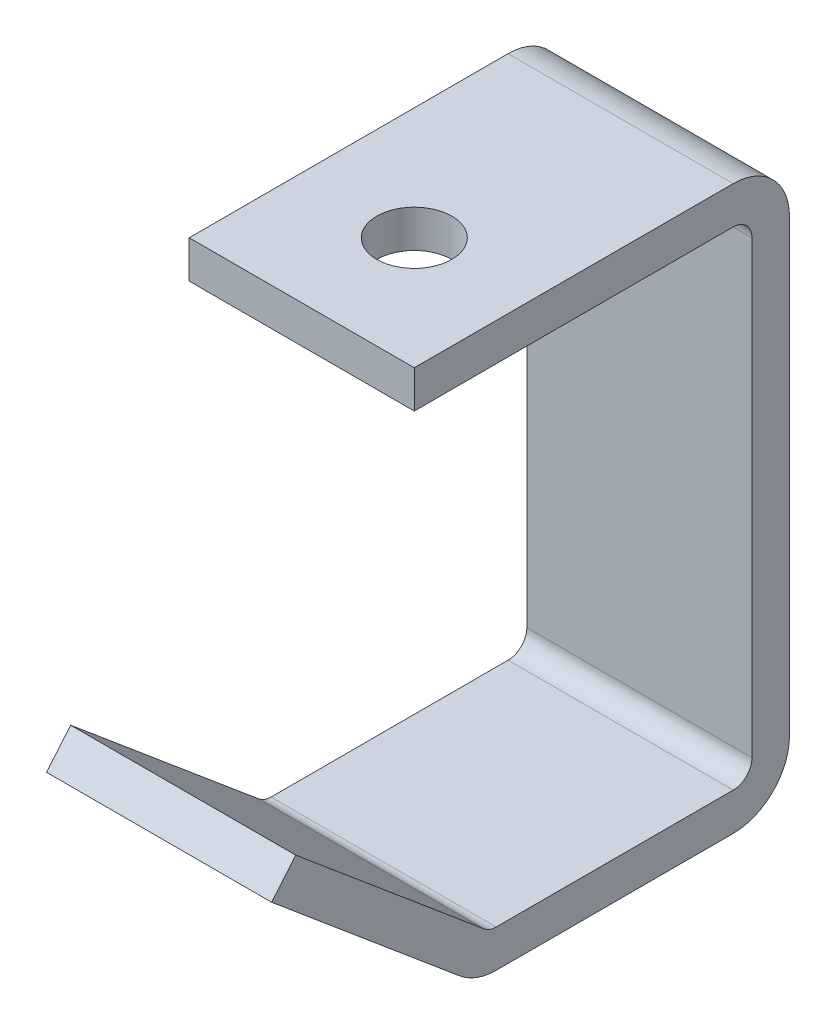
from build123d import *

# Parameters (mm, degrees)
BOSS_EXTRUDE1_DEPTH = 19.05
SHELL1_T            = 6.35
FILLET1_R           = 3.175
FILLET2_R           = 9.525
CUT_EXTRUDE1_REACH  = 128.663
SKETCH2_R           = 6.35


with BuildPart() as part:
    # Sketch1 → Boss-Extrude1 (new, symmetric)
    with BuildSketch(Plane(origin=(0, 0, 0), x_dir=(0, 0, -1), z_dir=(1, 0, 0))):
        Polygon((-57.15, 82.55), (0, 82.55), (0, 0), (-44.45, 0), (-77.208974413, 27.488043348), (-57.15, 51.393398168), align=None)
    extrude(amount=BOSS_EXTRUDE1_DEPTH, both=True)

    # Shell1
    shell1_openings = [part.faces().sort_by_distance(p)[0] for p in [
        (19.05, 40.856533518, 31.097326269),
        (0, 39.440720758, 67.179487206),
        (-19.05, 40.856533518, 31.097326269),
        (0, 66.971699084, 57.15),
    ]]
    offset(amount=SHELL1_T, openings=shell1_openings, kind=Kind.INTERSECTION)

    # Fillet1
    # the kernel refuses this fillet: 3.175 mm, written as the material it adds along each edge
    with BuildSketch(Plane(origin=(19.05, 0, 0), x_dir=(0, 0, 1), z_dir=(-1, 0, 0)), Plane(origin=(19.05, 82.55, 0), x_dir=(0, -1, 0), z_dir=(-1, 0, 0))) as fillet1_piece_1:
        with BuildLine():
            CenterArc((FILLET1_R, FILLET1_R), FILLET1_R, 180, 90)
            Line((0, FILLET1_R), (0, 0))
            Line((0, 0), (FILLET1_R, 0))
        make_face()
    extrude(amount=38.1)
    with BuildSketch(Plane(origin=(19.05, 0, 44.45), x_dir=(0, 0.6427876096865391, 0.7660444431189782), z_dir=(-1, 0, 0))) as fillet1_piece_2:
        with BuildLine():
            CenterArc((FILLET1_R * 0.363970234266, FILLET1_R), FILLET1_R, 230, 40)
            Line((-FILLET1_R * 0.27881737542, FILLET1_R * 0.233955556881), (0, 0))
            Line((0, 0), (FILLET1_R * 0.363970234266, 0))
        make_face()
    extrude(amount=38.1)

    # Fillet2
    fillet2_edges = [part.edges().sort_by_distance(p)[0] for p in [
        (0, -6.35, 46.761210988),
        (0, -6.35, -6.35),
        (0, 88.9, -6.35),
    ]]
    fillet(fillet2_edges, radius=FILLET2_R)

    # Sketch2 → Cut-Extrude1 (cut, up to next)
    with BuildSketch(Plane(origin=(0, 88.9, 0), x_dir=(-1, 0, 0), z_dir=(0, 1, 0)), mode=Mode.PRIVATE) as cut_extrude1_sk1:
        with Locations(Location((0, 38.1, 0), (0, 0, 90))):
            Circle(SKETCH2_R)
    cut_extrude1_tool1 = extrude(cut_extrude1_sk1.sketch, amount=-CUT_EXTRUDE1_REACH, mode=Mode.PRIVATE) & part.part
    add(cut_extrude1_tool1.solids().sort_by_distance((0, 88.9, 38.1))[0], mode=Mode.SUBTRACT)


solid = part.part
